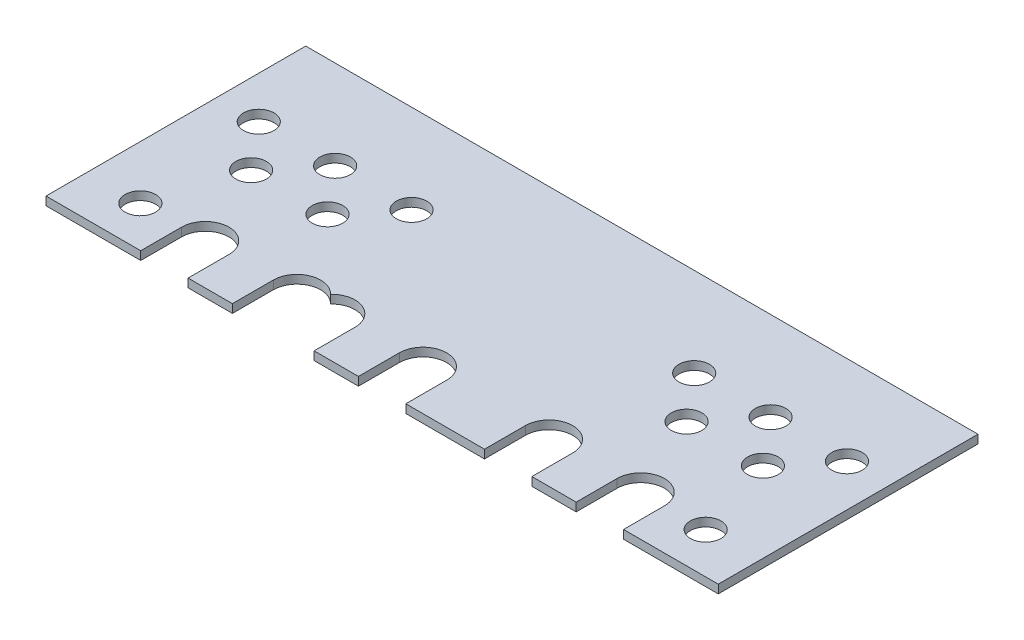
from build123d import *

# Parameters (mm, degrees)
SKETCH1_W           = 88
SKETCH1_H           = 34
BOSS_EXTRUDE1_DEPTH = 1.11
SKETCH2_R           = 2
CUT_EXTRUDE1_DEPTH  = 48.182964087
SKETCH3_R           = 2
CUT_EXTRUDE2_DEPTH  = 48.182964087
CUT_EXTRUDE3_DEPTH  = 48.182964087


with BuildPart() as part:
    # Sketch1 → Boss-Extrude1 (new body)
    with BuildSketch(Plane(origin=(0, 0, 0), x_dir=(1, 0, 0), z_dir=(0, 1, 0))):
        Rectangle(SKETCH1_W, SKETCH1_H)
    extrude(amount=BOSS_EXTRUDE1_DEPTH)

    # Sketch2 → Cut-Extrude1 (cut, through all)
    with BuildSketch(Plane(origin=(0, 1.11, 0), x_dir=(1, 0, 0), z_dir=(0, 1, 0))):
        with Locations((-38.5, 5.35)):
            Circle(SKETCH2_R)
        with Locations((-28.5, 5.35)):
            Circle(SKETCH2_R)
        with Locations((-18.5, 5.35)):
            Circle(SKETCH2_R)
        with Locations((-33.5, -0.65)):
            Circle(SKETCH2_R)
        with Locations((-23.5, -0.65)):
            Circle(SKETCH2_R)
        with Locations((18.5, 5.35)):
            Circle(SKETCH2_R)
        with Locations((28.5, 5.35)):
            Circle(SKETCH2_R)
        with Locations((38.5, 5.35)):
            Circle(SKETCH2_R)
        with Locations((23.5, -0.65)):
            Circle(SKETCH2_R)
        with Locations((33.5, -0.65)):
            Circle(SKETCH2_R)
    extrude(amount=-CUT_EXTRUDE1_DEPTH, mode=Mode.SUBTRACT)

    # Sketch3 → Cut-Extrude2 (cut, through all)
    with BuildSketch(Plane(origin=(0, 1.11, 0), x_dir=(1, 0, 0), z_dir=(0, 1, 0))):
        with Locations((-37, -11.65)):
            Circle(SKETCH3_R)
        with Locations((37, -11.65)):
            Circle(SKETCH3_R)
    extrude(amount=-CUT_EXTRUDE2_DEPTH, mode=Mode.SUBTRACT)

    # Sketch4 → Cut-Extrude3 (cut, through all)
    with BuildSketch(Plane(origin=(0, 1.11, 0), x_dir=(1, 0, 0), z_dir=(0, 1, 0))):
        with BuildLine():
            Line((-31.6, -11.65), (-31.6, -17))
            Line((-31.6, -17), (-25.4, -17))
            Line((-25.4, -17), (-25.4, -11.65))
            ThreePointArc((-25.4, -11.65), (-28.5, -8.55), (-31.6, -11.65))
        make_face()
        with BuildLine():
            Line((-19.6, -11.65), (-19.6, -17))
            Line((-19.6, -17), (-8.9, -17))
            Line((-8.9, -17), (-8.9, -11.65))
            ThreePointArc((-8.9, -11.65), (-10.852175972, -8.77032988), (-14.25, -9.517513189))
            ThreePointArc((-14.25, -9.517513189), (-17.647824028, -8.77032988), (-19.6, -11.65))
        make_face()
        with BuildLine():
            Line((13.4, -11.65), (13.4, -17))
            Line((13.4, -17), (19.6, -17))
            Line((19.6, -17), (19.6, -11.65))
            ThreePointArc((19.6, -11.65), (16.5, -8.55), (13.4, -11.65))
        make_face()
        with BuildLine():
            Line((25.4, -11.65), (25.4, -17))
            Line((25.4, -17), (31.6, -17))
            Line((31.6, -17), (31.6, -11.65))
            ThreePointArc((31.6, -11.65), (28.5, -8.55), (25.4, -11.65))
        make_face()
        with BuildLine():
            Line((-3.1, -11.65), (-3.1, -17))
            Line((-3.1, -17), (3.1, -17))
            Line((3.1, -17), (3.1, -11.65))
            ThreePointArc((3.1, -11.65), (0, -8.55), (-3.1, -11.65))
        make_face()
    extrude(amount=-CUT_EXTRUDE3_DEPTH, mode=Mode.SUBTRACT)


solid = part.part
